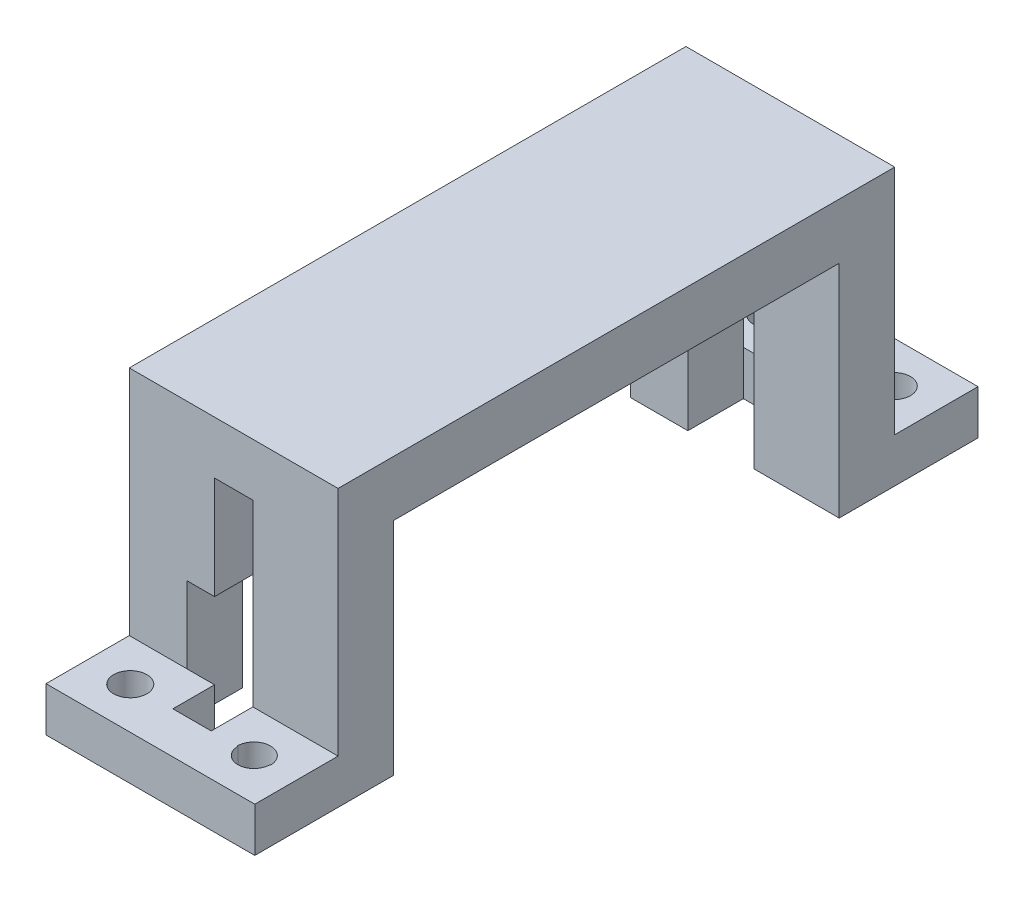
from build123d import *

# Parameters (mm, degrees)
BOSS_EXTRUDE1_DEPTH     = 18.8
SKETCH2_W               = 3.45
SKETCH2_H               = 20.125
CUT_EXTRUDE1_DEPTH      = 73.204371405
CUT_EXTRUDE2_REACH      = 45.006
SKETCH3_R               = 1.5
BOSS_EXTRUDE2_REACH     = 44.46
SKETCH7_W               = 3.75
SKETCH7_H               = 4
CUT_EXTRUDE8_DEPTH      = 2.5
MIRROR2_COPY_1_REACH    = 44.46
MIRROR2_COPY_1_SKETCH_W = 3.75
MIRROR2_COPY_1_SKETCH_H = 4
MIRROR2_COPY_2_REACH    = 44.46
MIRROR2_COPY_2_SKETCH_W = 3.75
MIRROR2_COPY_2_SKETCH_H = 4
SKETCH8_R               = 1.5
SKETCH8_R_2             = 1.435733502
CUT_EXTRUDE9_DEPTH      = 2.5


with BuildPart() as part:
    # Sketch1 → Boss-Extrude1 (new body)
    with BuildSketch(Plane(origin=(0, 0, 0), x_dir=(0, 0, -1), z_dir=(1, 0, 0))):
        Polygon((-25.0625, 0), (25.0625, 0), (25.0625, -20.875), (32.5625, -20.875), (32.5625, -24.875), (25.0625, -24.875), (20.0625, -24.875), (20.0625, -5), (-20.0625, -5), (-20.0625, -24.875), (-25.0625, -24.875), (-32.5625, -24.875), (-32.5625, -20.875), (-25.0625, -20.875), align=None)
    extrude(amount=BOSS_EXTRUDE1_DEPTH)

    # Sketch2 → Cut-Extrude1 (cut, through all)
    with BuildSketch(Plane.XY.offset(32.5625)):
        with Locations((9.4, -14.8125)):
            Rectangle(SKETCH2_W, SKETCH2_H)
    extrude(amount=-CUT_EXTRUDE1_DEPTH, mode=Mode.SUBTRACT)

    # Sketch3 → Cut-Extrude2 (cut, up to next)
    with BuildSketch(Plane(origin=(0, -20.875, 0), x_dir=(1, 0, 0), z_dir=(0, 1, 0)), mode=Mode.PRIVATE) as cut_extrude2_sk1:
        with Locations((3.8375, -28.8125)):
            Circle(SKETCH3_R)
    cut_extrude2_tool1 = extrude(cut_extrude2_sk1.sketch, amount=-CUT_EXTRUDE2_REACH, mode=Mode.PRIVATE) & part.part
    # Sketch3 → Cut-Extrude2 (cut, up to next)
    with BuildSketch(Plane(origin=(0, -20.875, 0), x_dir=(1, 0, 0), z_dir=(0, 1, 0)), mode=Mode.PRIVATE) as cut_extrude2_sk2:
        with Locations((14.9625, -28.8125)):
            Circle(SKETCH3_R)
    cut_extrude2_tool2 = extrude(cut_extrude2_sk2.sketch, amount=-CUT_EXTRUDE2_REACH, mode=Mode.PRIVATE) & part.part
    # Sketch3 → Cut-Extrude2 (cut, up to next)
    with BuildSketch(Plane(origin=(0, -20.875, 0), x_dir=(1, 0, 0), z_dir=(0, 1, 0)), mode=Mode.PRIVATE) as cut_extrude2_sk3:
        with Locations((14.9625, 28.8125)):
            Circle(SKETCH3_R)
    cut_extrude2_tool3 = extrude(cut_extrude2_sk3.sketch, amount=-CUT_EXTRUDE2_REACH, mode=Mode.PRIVATE) & part.part
    # Sketch3 → Cut-Extrude2 (cut, up to next)
    with BuildSketch(Plane(origin=(0, -20.875, 0), x_dir=(1, 0, 0), z_dir=(0, 1, 0)), mode=Mode.PRIVATE) as cut_extrude2_sk4:
        with Locations((3.8375, 28.8125)):
            Circle(SKETCH3_R)
    cut_extrude2_tool4 = extrude(cut_extrude2_sk4.sketch, amount=-CUT_EXTRUDE2_REACH, mode=Mode.PRIVATE) & part.part
    add(cut_extrude2_tool1.solids().sort_by_distance((3.8375, -20.875, 28.8125))[0], mode=Mode.SUBTRACT)
    add(cut_extrude2_tool2.solids().sort_by_distance((14.9625, -20.875, 28.8125))[0], mode=Mode.SUBTRACT)
    add(cut_extrude2_tool3.solids().sort_by_distance((14.9625, -20.875, -28.8125))[0], mode=Mode.SUBTRACT)
    add(cut_extrude2_tool4.solids().sort_by_distance((3.8375, -20.875, -28.8125))[0], mode=Mode.SUBTRACT)

    # Sketch7 → Boss-Extrude2 (add, up to next)
    with BuildSketch(Plane(origin=(7.675, 0, 0), x_dir=(0, 0, -1), z_dir=(1, 0, 0)), mode=Mode.PRIVATE) as boss_extrude2_sk1:
        with Locations((-30.6875, -22.875)):
            Rectangle(SKETCH7_W, SKETCH7_H)
    boss_extrude2_tool1 = extrude(boss_extrude2_sk1.sketch, amount=BOSS_EXTRUDE2_REACH, mode=Mode.PRIVATE) - part.part
    boss_extrude2 = boss_extrude2_tool1.solids().sort_by_distance((7.675, -22.875, 30.6875))[0]
    add(boss_extrude2)

    # Mirror1: Boss-Extrude2 across plane
    add(boss_extrude2.mirror(Plane.XY))

    # Sketch4 → Cut-Extrude8 (cut)
    with BuildSketch(Plane(origin=(7.675, 0, 0), x_dir=(0, 0, -1), z_dir=(1, 0, 0))):
        Polygon((-20.0625, -24.875), (-20.0625, -15.75), (-20.0625, -14), (-25.0625, -14), (-25.0625, -15.75), (-25.0625, -24.875), align=None)
    cut_extrude8 = extrude(amount=-CUT_EXTRUDE8_DEPTH, mode=Mode.SUBTRACT)

    # Mirror2: Cut-Extrude8 across plane
    add(cut_extrude8.mirror(Plane.XY), mode=Mode.SUBTRACT)

    # Mirror2 copy 1 sketch → Mirror2 copy 1 (add, up to next)
    with BuildSketch(Plane(origin=(7.675, 0, 0), x_dir=(0, 0, -1), z_dir=(1, 0, 0)), mode=Mode.PRIVATE) as mirror2_copy_1_sk1:
        with Locations((-30.6875, -22.875)):
            Rectangle(MIRROR2_COPY_1_SKETCH_W, MIRROR2_COPY_1_SKETCH_H)
    mirror2_copy_1_tool1 = extrude(mirror2_copy_1_sk1.sketch, amount=MIRROR2_COPY_1_REACH, mode=Mode.PRIVATE) - part.part
    add(mirror2_copy_1_tool1.solids().sort_by_distance((7.675, -22.875, 30.6875))[0])

    # Mirror2 copy 2 sketch → Mirror2 copy 2 (add, up to next)
    with BuildSketch(Plane(origin=(7.675, 0, 0), x_dir=(0, 0, 1), z_dir=(1, 0, 0)), mode=Mode.PRIVATE) as mirror2_copy_2_sk1:
        with Locations((-30.6875, 22.875)):
            Rectangle(MIRROR2_COPY_2_SKETCH_W, MIRROR2_COPY_2_SKETCH_H)
    mirror2_copy_2_tool1 = extrude(mirror2_copy_2_sk1.sketch, amount=MIRROR2_COPY_2_REACH, mode=Mode.PRIVATE) - part.part
    add(mirror2_copy_2_tool1.solids().sort_by_distance((7.675, -22.875, -30.6875))[0])

    # Sketch8 → Cut-Extrude9 (cut)
    with BuildSketch(Plane(origin=(0, -20.875, 0), x_dir=(1, 0, 0), z_dir=(0, 1, 0))):
        with Locations((14.9625, 28.8125)):
            Circle(SKETCH8_R)
        with Locations((14.9625, -28.8125)):
            Circle(SKETCH8_R_2)
    extrude(amount=-CUT_EXTRUDE9_DEPTH, mode=Mode.SUBTRACT)


solid = part.part
